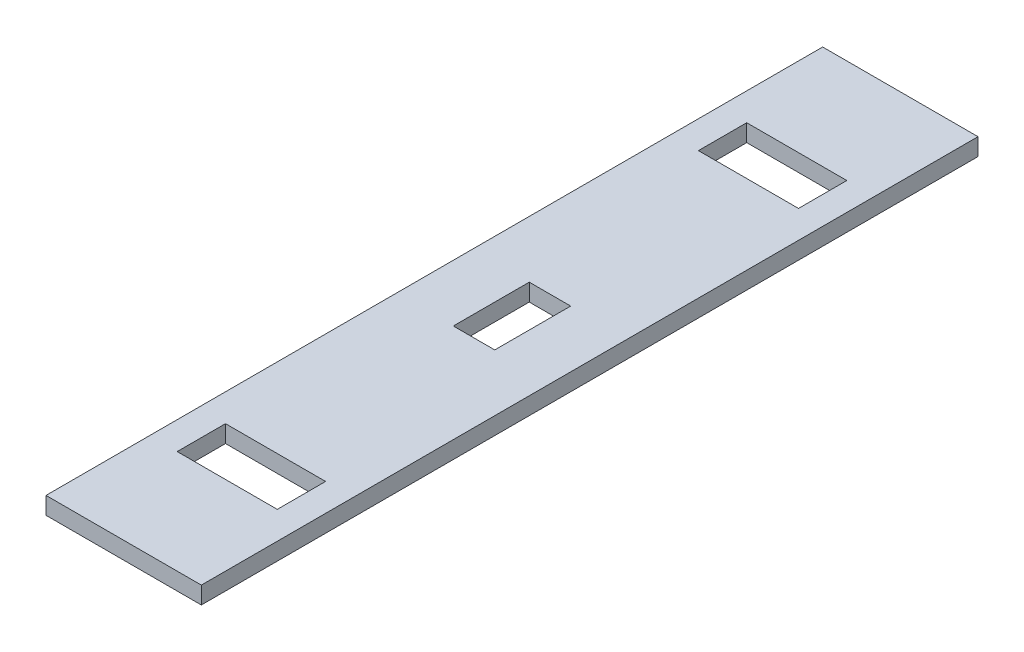
from build123d import *

# Parameters (mm, degrees)
ESQUISSE1_W                  = 9
ESQUISSE1_H                  = 45
ESQUISSE1_W_2                = 5.8
ESQUISSE1_H_2                = 2.8
BOSS_EXTRU_1_DEPTH           = 1
ENL_V_MAT_EXTRU_1_DEPTH      = 44.853203219
ENL_V_MAT_EXTRU_1_DEPTH_BACK = 44.853203219
ESQUISSE2_W                  = 2.4
ESQUISSE2_H                  = 4.4


with BuildPart() as part:
    # Esquisse1 → Boss.-Extru.1 (new body)
    with BuildSketch(Plane(origin=(0, 0, 0), x_dir=(1, 0, 0), z_dir=(0, 1, 0))):
        with Locations((3.408982136, 20.622516556)):
            Rectangle(ESQUISSE1_W, ESQUISSE1_H)
        with Locations((3.408982136, 5.522516556)):
            Rectangle(ESQUISSE1_W_2, ESQUISSE1_H_2, mode=Mode.SUBTRACT)
        with Locations((3.408982136, 35.722516556)):
            Rectangle(ESQUISSE1_W_2, ESQUISSE1_H_2, mode=Mode.SUBTRACT)
    extrude(amount=BOSS_EXTRU_1_DEPTH)

    # Esquisse2 → Enlèv. mat.-Extru.1 (cut, two sides: drawn at the far end of the back side and taken through both)
    with BuildSketch(Plane.XZ.offset(-ENL_V_MAT_EXTRU_1_DEPTH_BACK)):
        with Locations((3.408982136, -20.622516556)):
            Rectangle(ESQUISSE2_W, ESQUISSE2_H)
    extrude(amount=ENL_V_MAT_EXTRU_1_DEPTH + ENL_V_MAT_EXTRU_1_DEPTH_BACK, mode=Mode.SUBTRACT)


solid = part.part
